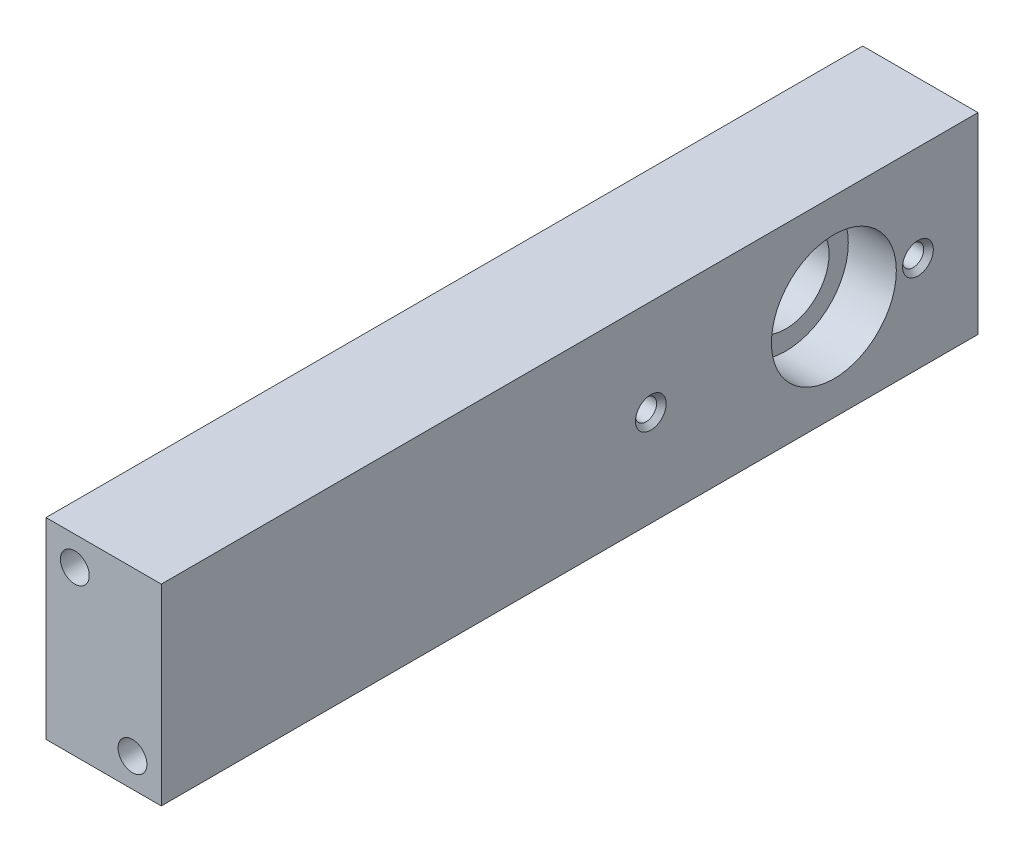
from build123d import *

# Parameters (mm, degrees)
SZKIC1_W                    = 12
SZKIC1_H                    = 20
DODANIE_WYCI_GNI_CIE1_DEPTH = 85
SZKIC2_R                    = 1.5
WYTNIJ_WYCI_GNI_CIE1_DEPTH  = 10
SZKIC4_R                    = 6.5
WYTNIJ_WYCI_GNI_CIE2_DEPTH  = 5
SZKIC5_R                    = 4.5
WYTNIJ_WYCI_GNI_CIE3_DEPTH  = 87.423376467
SZKIC6_R                    = 1.1
WYTNIJ_WYCI_GNI_CIE4_DEPTH  = 87.423376467
SFAZOWANIE1_SIZE            = 0.5
SZKIC7_R                    = 1.1
WYTNIJ_WYCI_GNI_CIE5_DEPTH  = 87.423376467
SFAZOWANIE2_SIZE            = 0.5


with BuildPart() as part:
    # Szkic1 → Dodanie-wyciągnięcie1 (new body)
    with BuildSketch(Plane.XY):
        Rectangle(SZKIC1_W, SZKIC1_H)
    extrude(amount=DODANIE_WYCI_GNI_CIE1_DEPTH)

    # Szkic2 → Wytnij-wyciągnięcie1 (cut)
    with BuildSketch(Plane.XY.offset(85)):
        with Locations((-3, 7)):
            Circle(SZKIC2_R)
        with Locations((3, -7)):
            Circle(SZKIC2_R)
    extrude(amount=-WYTNIJ_WYCI_GNI_CIE1_DEPTH, mode=Mode.SUBTRACT)

    # Szkic4 → Wytnij-wyciągnięcie2 (cut)
    with BuildSketch(Plane(origin=(6, 0, 0), x_dir=(0, 0, -1), z_dir=(1, 0, 0))):
        with Locations((-15, 0)):
            Circle(SZKIC4_R)
    extrude(amount=-WYTNIJ_WYCI_GNI_CIE2_DEPTH, mode=Mode.SUBTRACT)

    # Szkic5 → Wytnij-wyciągnięcie3 (cut, through all)
    with BuildSketch(Plane.ZY.offset(6)):
        with Locations((15, 0)):
            Circle(SZKIC5_R)
    extrude(amount=-WYTNIJ_WYCI_GNI_CIE3_DEPTH, mode=Mode.SUBTRACT)

    # Szkic6 → Wytnij-wyciągnięcie4 (cut, through all)
    with BuildSketch(Plane.ZY.offset(6)):
        with Locations((34.05, 0)):
            Circle(SZKIC6_R)
    extrude(amount=-WYTNIJ_WYCI_GNI_CIE4_DEPTH, mode=Mode.SUBTRACT)

    # Sfazowanie1
    sfazowanie1_edges = [part.edges().sort_by_distance(p)[0] for p in [
        (6, 0, 32.95),
    ]]
    chamfer(sfazowanie1_edges, length=SFAZOWANIE1_SIZE)

    # Szkic7 → Wytnij-wyciągnięcie5 (cut, through all)
    with BuildSketch(Plane.ZY.offset(6)):
        with Locations((6.25, 0)):
            Circle(SZKIC7_R)
    extrude(amount=-WYTNIJ_WYCI_GNI_CIE5_DEPTH, mode=Mode.SUBTRACT)

    # Sfazowanie2
    sfazowanie2_edges = [part.edges().sort_by_distance(p)[0] for p in [
        (6, 0, 5.15),
    ]]
    chamfer(sfazowanie2_edges, length=SFAZOWANIE2_SIZE)


solid = part.part
